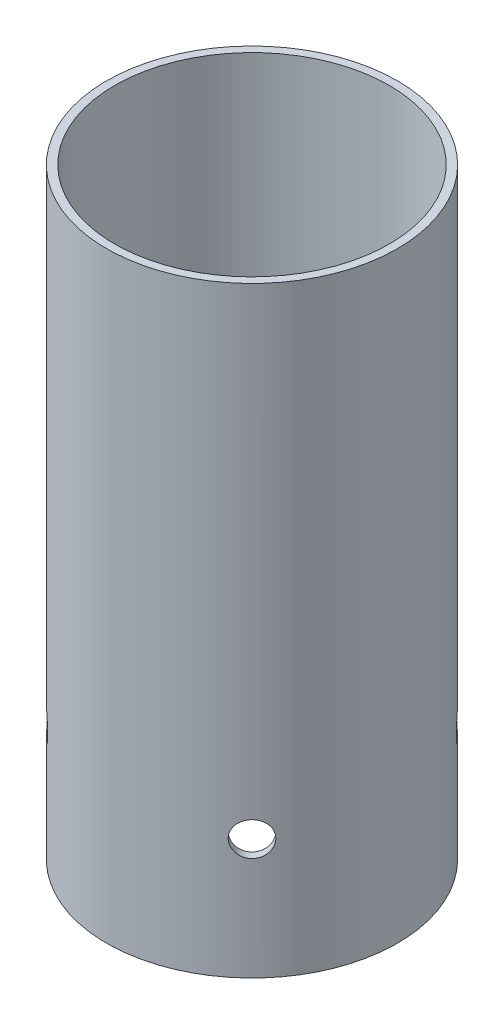
from build123d import *

# Parameters (mm, degrees)
SKETCH1_W          = 0.85
SKETCH1_H          = 63.5
SKETCH2_R          = 1.778
CUT_EXTRUDE1_DEPTH = 2.54
CIRPATTERN1_COUNT  = 4


with BuildPart() as part:
    # Sketch1 → Revolve1 (revolve)
    with BuildSketch(Plane.XY):
        with Locations((-14.925, 285.75)):
            Rectangle(SKETCH1_W, SKETCH1_H)
    revolve(axis=Axis((0, 0, 0), (0, 1, 0)))

    # Sketch2 → Cut-Extrude1 (cut)
    with BuildSketch(Plane(origin=(-10.854089091, 0, 10.854089091), x_dir=(0, -1, 0), z_dir=(-0.7071067811865488, 0, 0.7071067811865464))):
        with Locations((-266.7, 0)):
            Circle(SKETCH2_R)
    cut_extrude1 = extrude(amount=-CUT_EXTRUDE1_DEPTH, mode=Mode.SUBTRACT)

    # CirPattern1: Cut-Extrude1 ×4 about axis
    cirpattern1_axis = Axis((0, 317.5, 0), (0, -1, 0))
    for i in range(1, CIRPATTERN1_COUNT):
        add(cut_extrude1.rotate(cirpattern1_axis, i * 360 / CIRPATTERN1_COUNT), mode=Mode.SUBTRACT)


solid = part.part
